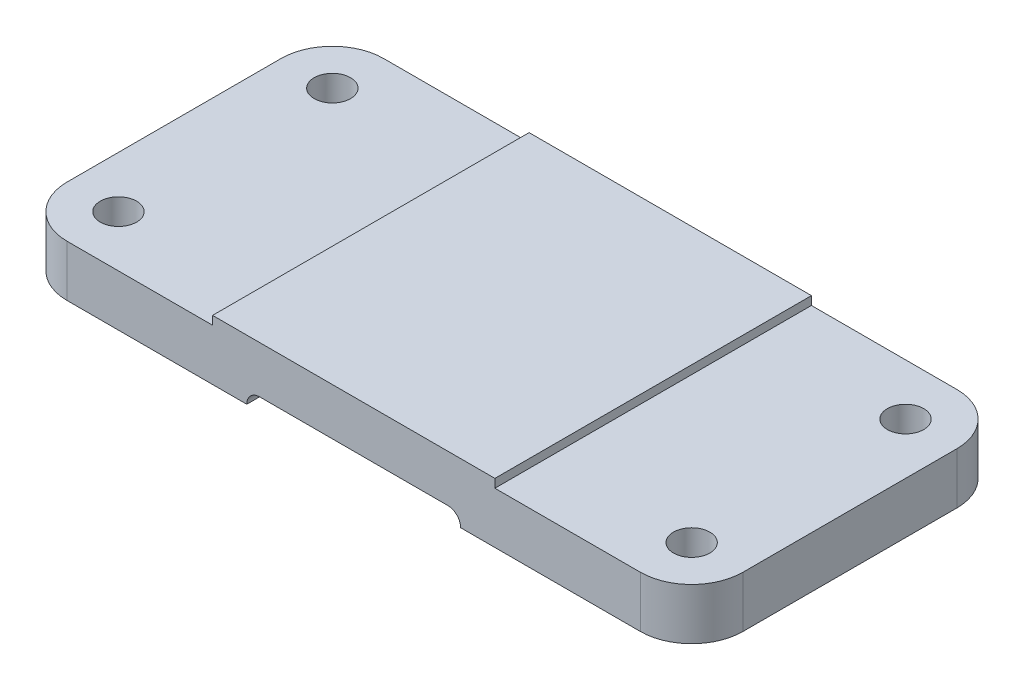
from build123d import *

# Parameters (mm, degrees)
BOSS_EXTRUDE1_DEPTH    = 74
FILLET1_R              = 12
M10_TAPPED_HOLE1_D     = 8.5
M10_TAPPED_HOLE1_DEPTH = 24.5
M10_TAPPED_HOLE1_TIP   = 2.553657631


with BuildPart() as part:
    # Sketch1 → Boss-Extrude1 (new body)
    with BuildSketch(Plane.XY):
        with BuildLine():
            Line((-8.61784001, -8.193885901), (35.38215999, -8.193885901))
            ThreePointArc((35.38215999, -8.193885901), (37.503480333, -9.072565558), (38.38215999, -11.193885901))
            Line((38.38215999, -11.193885901), (92.38215999, -11.193885901))
            Line((92.38215999, -11.193885901), (92.38215999, 0.806114099))
            Line((92.38215999, 0.806114099), (46.38215999, 0.806114099))
            Line((46.38215999, 0.806114099), (46.38215999, 2.806114099))
            Line((46.38215999, 2.806114099), (-19.61784001, 2.806114099))
            Line((-19.61784001, 2.806114099), (-19.61784001, 0.806114099))
            Line((-19.61784001, 0.806114099), (-65.61784001, 0.806114099))
            Line((-65.61784001, 0.806114099), (-65.61784001, -11.193885901))
            Line((-65.61784001, -11.193885901), (-11.61784001, -11.193885901))
            ThreePointArc((-11.61784001, -11.193885901), (-10.739160354, -9.072565558), (-8.61784001, -8.193885901))
        make_face()
    extrude(amount=BOSS_EXTRUDE1_DEPTH)

    # Fillet1
    fillet1_edges = [part.edges().sort_by_distance(p)[0] for p in [
        (92.38215999, -5.193885901, 0),
        (92.38215999, -5.193885901, 74),
        (-65.61784001, -5.193885901, 74),
        (-65.61784001, -5.193885901, 0),
    ]]
    fillet(fillet1_edges, radius=FILLET1_R)

    # M10 Tapped Hole1
    with Locations(Plane(origin=(80.38215999, 0.806114099, 62), x_dir=(0, 0, 1), z_dir=(0, 1, 0))):
        with Locations((0, 0), (-50, 0), (-50, -134), (0, -134)):
            Hole(M10_TAPPED_HOLE1_D / 2, depth=M10_TAPPED_HOLE1_DEPTH)
            with Locations((0, 0, -(M10_TAPPED_HOLE1_DEPTH + M10_TAPPED_HOLE1_TIP / 2))):  # 118° drill point
                Cone(0, M10_TAPPED_HOLE1_D / 2, M10_TAPPED_HOLE1_TIP, mode=Mode.SUBTRACT)


solid = part.part
